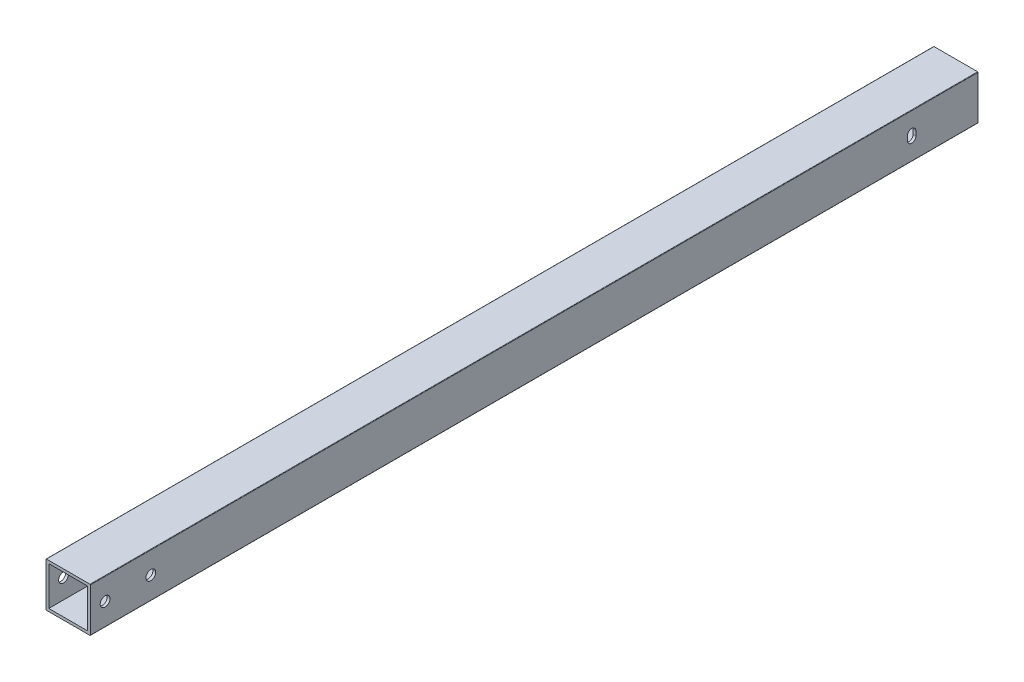
from build123d import *

# Parameters (mm, degrees)
SKETCH1_W           = 22.225
SKETCH1_H           = 22.225
BOSS_EXTRUDE1_DEPTH = 508
CUT_EXTRUDE2_DEPTH  = 510.191707666
SKETCH5_R           = 2.794
CUT_EXTRUDE3_DEPTH  = 25.4


with BuildPart() as part:
    # Sketch1 → Boss-Extrude1 (new body)
    with BuildSketch(Plane(origin=(0, 0, 0), x_dir=(-1, 0, 0), z_dir=(0, 0, -1))):
        with BuildLine():
            Line((1.5875, -1.3335), (1.5875, 23.5585))
            ThreePointArc((1.5875, 23.5585), (1.513105122, 23.738105122), (1.3335, 23.8125))
            Line((1.3335, 23.8125), (-23.5585, 23.8125))
            ThreePointArc((-23.5585, 23.8125), (-23.738105122, 23.738105122), (-23.8125, 23.5585))
            Line((-23.8125, 23.5585), (-23.8125, -1.3335))
            ThreePointArc((-23.8125, -1.3335), (-23.738105122, -1.513105122), (-23.5585, -1.5875))
            Line((-23.5585, -1.5875), (1.3335, -1.5875))
            ThreePointArc((1.3335, -1.5875), (1.513105122, -1.513105122), (1.5875, -1.3335))
        make_face()
        with Locations((-11.1125, 11.1125)):
            Rectangle(SKETCH1_W, SKETCH1_H, mode=Mode.SUBTRACT)
    extrude(amount=-BOSS_EXTRUDE1_DEPTH)

    # Sketch4 → Cut-Extrude2 (cut, through all)
    with BuildSketch(Plane(origin=(23.8125, 0, 0), x_dir=(0, 0, -1), z_dir=(1, 0, 0))):
        with BuildLine():
            ThreePointArc((-40.314518304, 9.8425), (-37.933268304, 7.46125), (-35.552018304, 9.8425))
            Line((-35.552018304, 9.8425), (-35.552018304, 12.3825))
            ThreePointArc((-35.552018304, 12.3825), (-37.933268304, 14.76375), (-40.314518304, 12.3825))
            Line((-40.314518304, 12.3825), (-40.314518304, 9.8425))
        make_face()
    extrude(amount=-CUT_EXTRUDE2_DEPTH, mode=Mode.SUBTRACT)

    # Sketch5 → Cut-Extrude3 (cut)
    with BuildSketch(Plane(origin=(23.8125, 0, 0), x_dir=(0, 0, -1), z_dir=(1, 0, 0))):
        with Locations((-499.577288815, 11.17096891)):
            Circle(SKETCH5_R)
        with Locations((-473.415288815, 11.17096891)):
            Circle(SKETCH5_R)
    extrude(amount=-CUT_EXTRUDE3_DEPTH, mode=Mode.SUBTRACT)


solid = part.part
